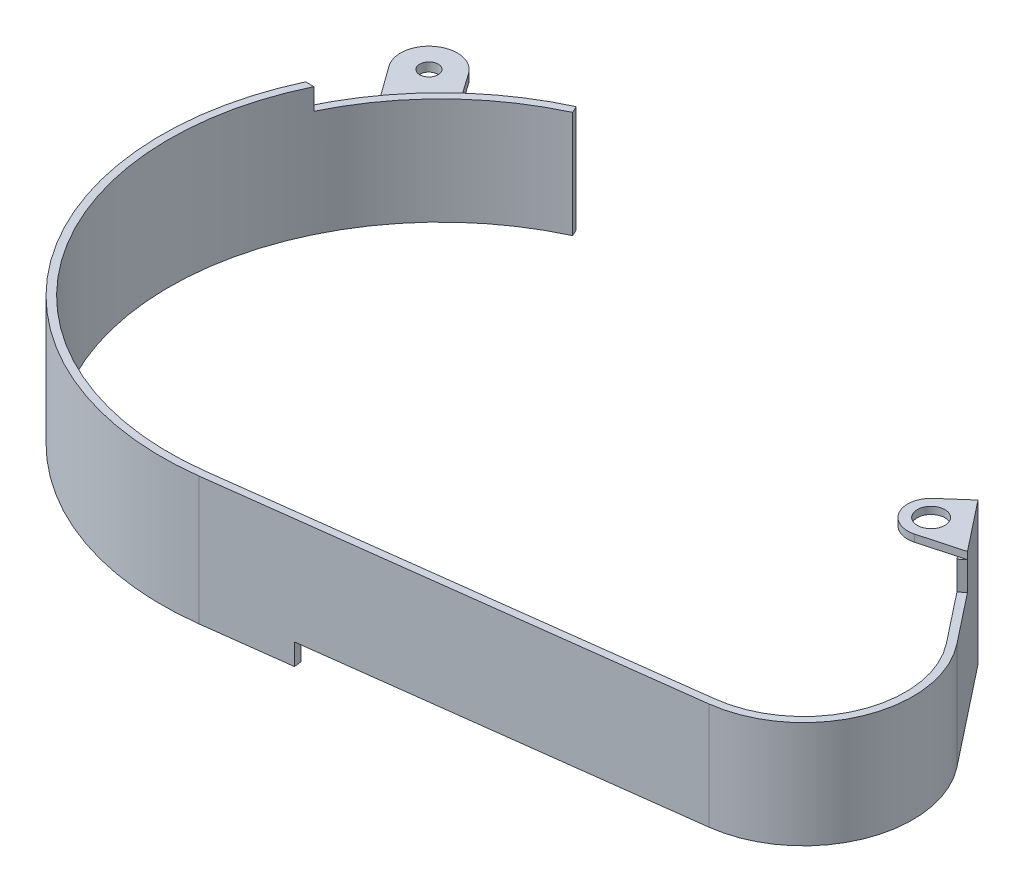
from build123d import *
from build123d.topology import SkipClean

# Parameters (mm, degrees)
BASE_FLANGE1_DEPTH  = 38.1
CUT_EXTRUDE1_DEPTH  = 7.62
SKETCH9_R           = 3.3
BOSS_EXTRUDE1_DEPTH = 3.175
BOSS_EXTRUDE2_DEPTH = 7.62
BOSS_EXTRUDE4_DEPTH = 10.16
SKETCH14_R          = 4.9022
BOSS_EXTRUDE5_DEPTH = 2.54


# Sheet-metal steps are written as plain solids
with BuildPart() as part:
    # Sketch1 → Base-Flange1 (new body)
    with BuildSketch(Plane(origin=(0, 0, 0), x_dir=(1, 0, 0), z_dir=(0, 1, 0))):
        with BuildLine():
            Line((-657.047015903, -180.398251424), (-495.540915967, -159.83264605))
            ThreePointArc((-495.540915967, -159.83264605), (-466.529161595, -137.56639807), (-471.621526187, -101.351269827))
            Line((-471.621526187, -101.351269827), (-499.562056453, -65.912999952))
            Line((-499.562056453, -65.912999952), (-497.56764915, -64.134999952))
            Line((-497.56764915, -64.134999952), (-469.527179345, -99.700027778))
            ThreePointArc((-469.527179345, -99.700027778), (-464.060656724, -138.576037958), (-495.204030033, -162.478283377))
            Line((-495.204030033, -162.478283377), (-656.710129969, -183.043888751))
            ThreePointArc((-656.710129969, -183.043888751), (-764.987734735, -111.822063922), (-711.2, 6.090902363))
            Line((-711.2, 6.090902363), (-710.077660148, 3.671554877))
            ThreePointArc((-710.077660148, 3.671554877), (-762.424972114, -111.083730158), (-657.047015903, -180.398251424))
        make_face()
    extrude(amount=-BASE_FLANGE1_DEPTH)

    # Sketch7 → Cut-Extrude1 (cut)
    with BuildSketch(Plane(origin=(-711.2, 0, -6.090902363), x_dir=(1, 0, 0), z_dir=(0, 1, 0))):
        with BuildLine():
            Line((1.122339852, -2.419347486), (0, 0))
            ThreePointArc((0, 0), (-28.443609249, -19.854342865), (-48.352212426, -48.26))
            Line((-48.352212426, -48.26), (-45.400744677, -48.26))
            ThreePointArc((-45.400744677, -48.26), (-26.116771828, -21.302890058), (1.122339852, -2.419347486))
        make_face()
    extrude(amount=-CUT_EXTRUDE1_DEPTH, mode=Mode.SUBTRACT)

    # Sketch9 → Boss-Extrude1 (add)
    with BuildSketch(Plane(origin=(0, -11.93175668, 0), x_dir=(1, 0, 0), z_dir=(0, 1, 0))):
        with BuildLine():
            ThreePointArc((-745.00372812, 1.45947251), (-759.199076387, 3.906966827), (-761.574552778, -10.300610474))
            Line((-761.574552778, -10.300610474), (-750.190181644, -26.170892956))
            ThreePointArc((-750.190181644, -26.170892956), (-749.293417822, -24.941724272), (-748.377980117, -23.726399288))
            ThreePointArc((-748.377980117, -23.726399288), (-742.704728301, -16.957559782), (-736.454096434, -10.717962385))
            Line((-736.454096434, -10.717962385), (-745.00372812, 1.45947251))
        make_face()
        with Locations(Location((-753.318959287, -4.37855204, 0), (0, 0, 270))):
            Circle(SKETCH9_R, mode=Mode.SUBTRACT)
    extrude(amount=-BOSS_EXTRUDE1_DEPTH)

    # Sketch10 → Boss-Extrude2 (add)
    with SkipClean():  # the faces are left unmerged after this step: merging them gives an invalid solid
        with BuildSketch(Plane.XZ.offset(38.1)):
            with BuildLine():
                Line((-710.077660148, -3.671554877), (-711.2, -6.090902363))
                ThreePointArc((-711.2, -6.090902363), (-764.987734735, 111.822063922), (-656.710129969, 183.043888751))
                Line((-656.710129969, 183.043888751), (-626.474274799, 179.193763797))
                Line((-626.474274799, 179.193763797), (-626.811160733, 176.54812647))
                Line((-626.811160733, 176.54812647), (-657.047015903, 180.398251424))
                ThreePointArc((-657.047015903, 180.398251424), (-762.424972114, 111.083730158), (-710.077660148, -3.671554877))
            make_face()
        extrude(amount=BOSS_EXTRUDE2_DEPTH)

    # Sketch12 → Boss-Extrude4 (add)
    with SkipClean():  # the faces are left unmerged after this step: merging them gives an invalid solid
        with BuildSketch(Plane(origin=(0, 0, 0), x_dir=(1, 0, 0), z_dir=(0, 1, 0))):
            Polygon((-497.56764915, -64.134999952), (-499.562056453, -65.912999952), (-485.59179132, -83.632134889), (-483.547414248, -81.917513865), align=None)
        extrude(amount=BOSS_EXTRUDE4_DEPTH)

    # Sketch14 → Boss-Extrude5 (add)
    with SkipClean():  # the faces are left unmerged after this step: merging them gives an invalid solid
        with BuildSketch(Plane(origin=(0, 10.16, 0), x_dir=(1, 0, 0), z_dir=(0, 1, 0))):
            with BuildLine():
                Line((-483.547414248, -81.917513865), (-497.56764915, -64.134999952))
                Line((-497.56764915, -64.134999952), (-506.071656266, -71.613711984))
                ThreePointArc((-506.071656266, -71.613711984), (-507.911682699, -81.867815661), (-498.334671428, -85.968205228))
                Line((-498.334671428, -85.968205228), (-483.547414248, -81.917513865))
            make_face()
            with Locations(Location((-500.545493785, -77.897484492, 0), (0, 0, 270))):
                Circle(SKETCH14_R, mode=Mode.SUBTRACT)
        extrude(amount=BOSS_EXTRUDE5_DEPTH)


solid = part.part
